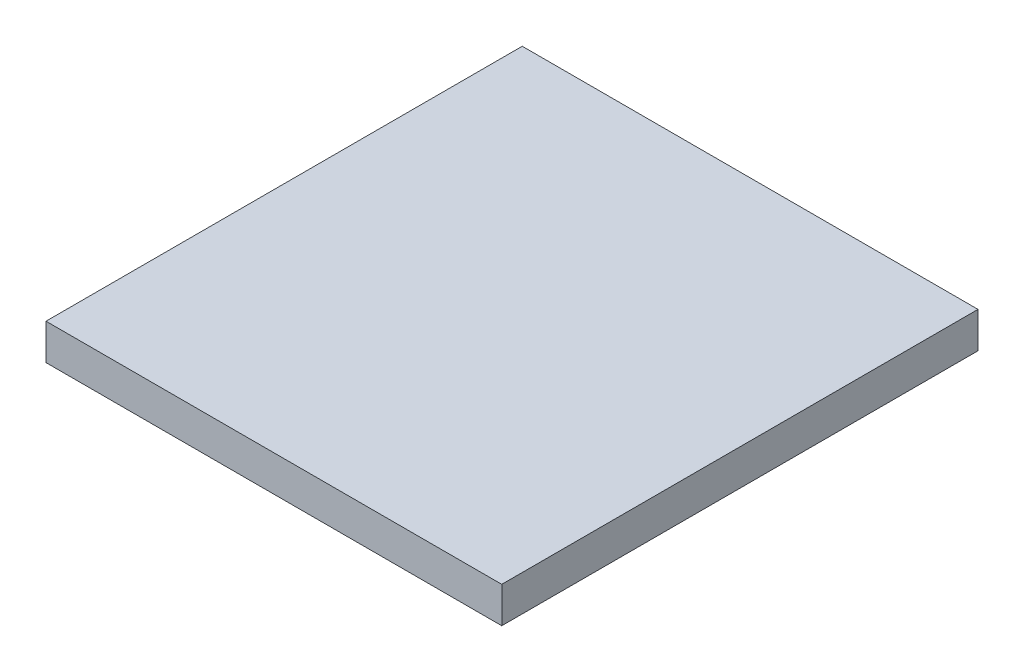
from build123d import *

# Parameters (mm, degrees)
SKETCH_1_W      = 20.32
SKETCH_1_H      = 21.234
EXTRUDE_1_DEPTH = 1.6


with BuildPart() as part:
    # Эскиз1 → Бобышка-Вытянуть1 (new body)
    with BuildSketch(Plane(origin=(0, 0, 0), x_dir=(1, 0, 0), z_dir=(0, 1, 0))):
        Rectangle(SKETCH_1_W, SKETCH_1_H)
    extrude(amount=EXTRUDE_1_DEPTH)


solid = part.part
